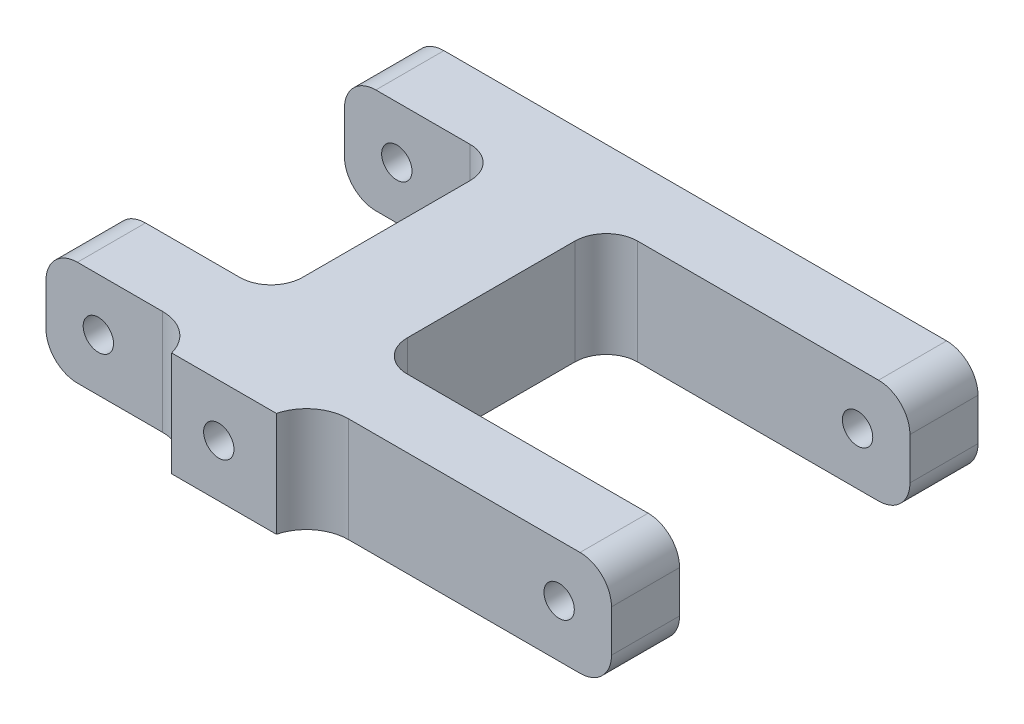
from build123d import *

# Parameters (mm, degrees)
SKETCH1_W               = 54
SKETCH1_H               = 35
BOSS_EXTRUDE1_DEPTH     = 10
SKETCH2_W               = 22
SKETCH2_H               = 10
CUT_EXTRUDE1_DEPTH      = 29
SKETCH3_W               = 22
SKETCH3_H               = 10
CUT_EXTRUDE2_DEPTH      = 15
SKETCH5_R               = 1.45
CUT_EXTRUDE4_DEPTH      = 66.122960621
FILLET1_R               = 3
FILLET2_R               = 3
SKETCH8_W               = 10
SKETCH8_H               = 10
BOSS_EXTRUDE2_DEPTH     = 3
CUT_EXTRUDE5_DEPTH      = 4
CUT_EXTRUDE5_DEPTH_BACK = 15
SKETCH6_R               = 1.45
FILLET3_R               = 4


with BuildPart() as part:
    # Sketch1 → Boss-Extrude1 (new body)
    with BuildSketch(Plane(origin=(0, 0, 0), x_dir=(1, 0, 0), z_dir=(0, 1, 0))):
        with Locations((27, -17.5)):
            Rectangle(SKETCH1_W, SKETCH1_H)
    extrude(amount=BOSS_EXTRUDE1_DEPTH)

    # Sketch2 → Cut-Extrude1 (cut)
    with BuildSketch(Plane(origin=(54, 0, 0), x_dir=(0, 0, -1), z_dir=(1, 0, 0))):
        with Locations((-17.5, 5)):
            Rectangle(SKETCH2_W, SKETCH2_H)
    extrude(amount=-CUT_EXTRUDE1_DEPTH, mode=Mode.SUBTRACT)

    # Sketch3 → Cut-Extrude2 (cut)
    with BuildSketch(Plane.ZY):
        with Locations((17.5, 5)):
            Rectangle(SKETCH3_W, SKETCH3_H)
    extrude(amount=-CUT_EXTRUDE2_DEPTH, mode=Mode.SUBTRACT)

    # Sketch5 → Cut-Extrude4 (cut, through all)
    with BuildSketch(Plane.XY.offset(35)):
        with Locations((5, 5)):
            Circle(SKETCH5_R)
        with Locations((49, 5)):
            Circle(SKETCH5_R)
    extrude(amount=-CUT_EXTRUDE4_DEPTH, mode=Mode.SUBTRACT)

    # Fillet1
    fillet1_edges = [part.edges().sort_by_distance(p)[0] for p in [
        (54, 10, 31.75),
        (54, 0, 3.25),
        (54, 10, 3.25),
        (0, 0, 31.75),
        (0, 10, 31.75),
        (0, 10, 3.25),
        (54, 0, 31.75),
        (0, 0, 3.25),
    ]]
    fillet(fillet1_edges, radius=FILLET1_R)

    # Fillet2
    fillet2_edges = [part.edges().sort_by_distance(p)[0] for p in [
        (25, 5, 28.5),
        (25, 5, 6.5),
        (15, 5, 6.5),
        (15, 5, 28.5),
    ]]
    fillet(fillet2_edges, radius=FILLET2_R)

    # Sketch8 → Boss-Extrude2 (add)
    with BuildSketch(Plane.XY.offset(35)):
        with Locations((20, 5)):
            Rectangle(SKETCH8_W, SKETCH8_H)
    extrude(amount=BOSS_EXTRUDE2_DEPTH)

    # Sketch6 → Cut-Extrude5 (cut, two sides: drawn at the far end of the back side and taken through both)
    with BuildSketch(Plane.XY.offset(35).offset(-CUT_EXTRUDE5_DEPTH_BACK)):
        with Locations((19.5, 5)):
            Circle(SKETCH6_R)
    extrude(amount=CUT_EXTRUDE5_DEPTH + CUT_EXTRUDE5_DEPTH_BACK, mode=Mode.SUBTRACT)

    # Fillet3
    # the kernel refuses this fillet: 4 mm, written as the material it adds along each edge
    with BuildSketch(Plane(origin=(25, 10, 35), x_dir=(0, 0, 1), z_dir=(0, -1, 0))) as fillet3_piece_1:
        with BuildLine():
            CenterArc((4, -3.872983346), FILLET3_R, 104.477512186, 75.522487814)
            Line((0, -3.872983346), (-0.08, -3.872983346))
            Line((-0.08, -3.872983346), (-0.08, 0))
            Line((-0.08, 0), (0, 0.08))
            ThreePointArc((0, 0.08), (1.5, 0.08), (2.98, 0.077459667))
            Line((2.98, 0.077459667), (3, 0))
        make_face()
    extrude(amount=10)
    with BuildSketch(Plane(origin=(15, 0, 35), x_dir=(-1, 0, 0), z_dir=(0, 1, 0))) as fillet3_piece_2:
        with BuildLine():
            CenterArc((3.872983346, 4), FILLET3_R, 194.477512186, 75.522487814)
            Line((0, 3), (-0.077459667, 2.98))
            ThreePointArc((-0.077459667, 2.98), (-0.08, 1.5), (-0.08, 0))
            Line((-0.08, 0), (0, -0.08))
            Line((0, -0.08), (3.872983346, -0.08))
            Line((3.872983346, -0.08), (3.872983346, 0))
        make_face()
    extrude(amount=10)


solid = part.part
